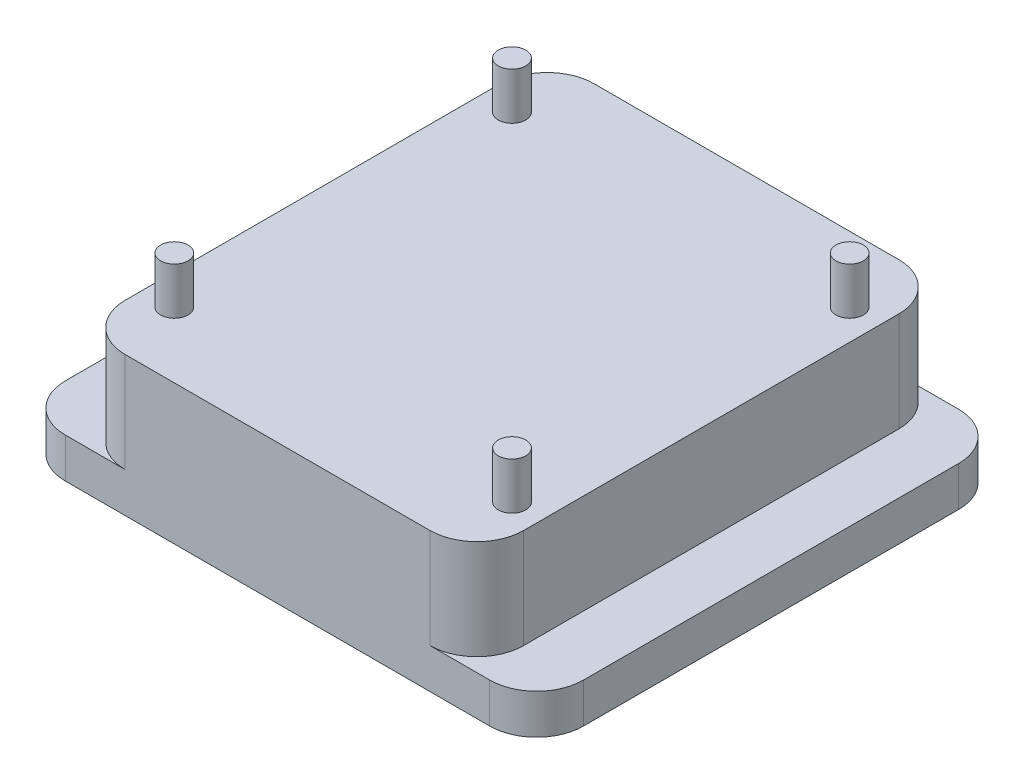
from build123d import *

# Parameters (mm, degrees)
BOSS_EXTRUDE1_DEPTH = 50.8
SKETCH2_R           = 1.4859
BOSS_EXTRUDE2_DEPTH = 5.08
FILLET1_R           = 5.08
FILLET2_R           = 5.08


with BuildPart() as part:
    # Sketch1 → Boss-Extrude1 (new body)
    with BuildSketch(Plane.XY):
        Polygon((-28.067, 2.159), (-28.067, -2.159), (28.067, -2.159), (28.067, 2.159), (21.59, 2.159), (21.59, 12.954), (-21.59, 12.954), (-21.59, 2.159), align=None)
    extrude(amount=BOSS_EXTRUDE1_DEPTH)

    # Sketch2 → Boss-Extrude2 (add)
    with BuildSketch(Plane(origin=(0, 12.954, 0), x_dir=(1, 0, 0), z_dir=(0, 1, 0))):
        with Locations((-18.288, -7.112)):
            Circle(SKETCH2_R)
        with Locations((18.288, -7.112)):
            Circle(SKETCH2_R)
        with Locations((18.288, -43.688)):
            Circle(SKETCH2_R)
        with Locations((-18.288, -43.688)):
            Circle(SKETCH2_R)
    extrude(amount=BOSS_EXTRUDE2_DEPTH)

    # Fillet1
    fillet1_edges = [part.edges().sort_by_distance(p)[0] for p in [
        (-21.59, 7.5565, 0),
        (21.59, 7.5565, 0),
        (21.59, 7.5565, 50.8),
        (-21.59, 7.5565, 50.8),
    ]]
    fillet(fillet1_edges, radius=FILLET1_R)

    # Fillet2
    fillet2_edges = [part.edges().sort_by_distance(p)[0] for p in [
        (-28.067, 0, 50.8),
        (-28.067, 0, 0),
        (28.067, 0, 50.8),
        (28.067, 0, 0),
    ]]
    fillet(fillet2_edges, radius=FILLET2_R)


solid = part.part
